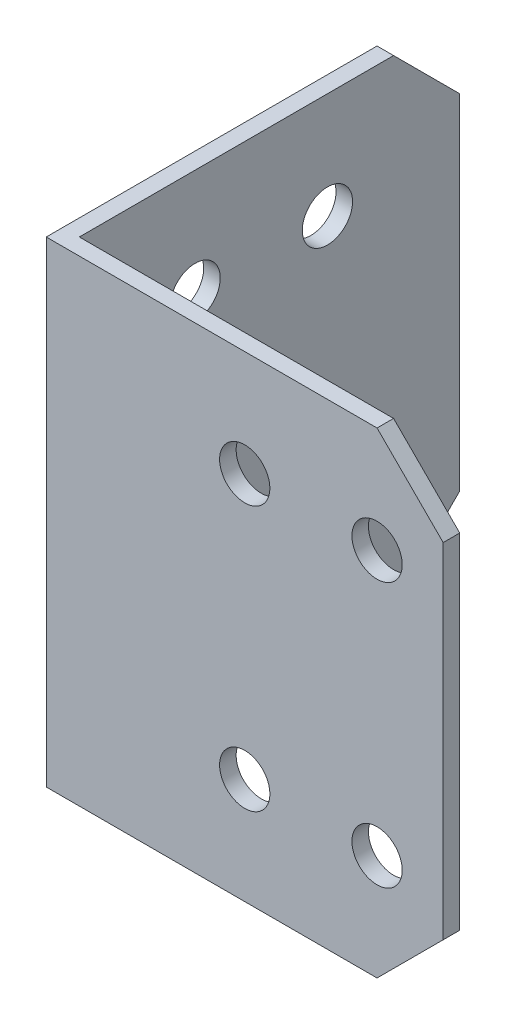
from build123d import *

# Parameters (mm, degrees)
BOSS_EXTRUDE1_DEPTH = 45.72
SKETCH2_R           = 2.413
CUT_EXTRUDE1_DEPTH  = 62.831308992
SKETCH3_R           = 2.413
CUT_EXTRUDE2_DEPTH  = 67.541817291
CHAMFER1_SIZE       = 6.35


with BuildPart() as part:
    # Sketch1 → Boss-Extrude1 (new body)
    with BuildSketch(Plane(origin=(0, 0, 0), x_dir=(1, 0, 0), z_dir=(0, 1, 0))):
        Polygon((-18.109259259, 31.691203704), (-16.521759259, 31.691203704), (-16.521759259, -4.821296296), (19.990740741, -4.821296296), (19.990740741, -6.408796296), (-18.109259259, -6.408796296), align=None)
    extrude(amount=BOSS_EXTRUDE1_DEPTH)

    # Sketch2 → Cut-Extrude1 (cut, through all)
    with BuildSketch(Plane(origin=(0, 0, 4.821296296), x_dir=(-1, 0, 0), z_dir=(0, 0, -1))):
        with Locations((-0.940740741, 35.56)):
            Circle(SKETCH2_R)
        with Locations((-13.640740741, 35.56)):
            Circle(SKETCH2_R)
        with Locations((-13.640740741, 10.16)):
            Circle(SKETCH2_R)
        with Locations((-0.940740741, 10.16)):
            Circle(SKETCH2_R)
    extrude(amount=-CUT_EXTRUDE1_DEPTH, mode=Mode.SUBTRACT)

    # Sketch3 → Cut-Extrude2 (cut, through all)
    with BuildSketch(Plane(origin=(-16.521759259, 0, 0), x_dir=(0, 0, -1), z_dir=(1, 0, 0))):
        with Locations((6.291203704, 35.56)):
            Circle(SKETCH3_R)
        with Locations((18.991203704, 35.56)):
            Circle(SKETCH3_R)
        with Locations((18.991203704, 10.16)):
            Circle(SKETCH3_R)
        with Locations((6.291203704, 10.16)):
            Circle(SKETCH3_R)
    extrude(amount=-CUT_EXTRUDE2_DEPTH, mode=Mode.SUBTRACT)

    # Chamfer1
    chamfer1_edges = [part.edges().sort_by_distance(p)[0] for p in [
        (19.990740741, 45.72, 5.615046296),
        (19.990740741, 0, 5.615046296),
        (-17.315509259, 0, -31.691203704),
        (-17.315509259, 45.72, -31.691203704),
    ]]
    chamfer(chamfer1_edges, length=CHAMFER1_SIZE)


solid = part.part
